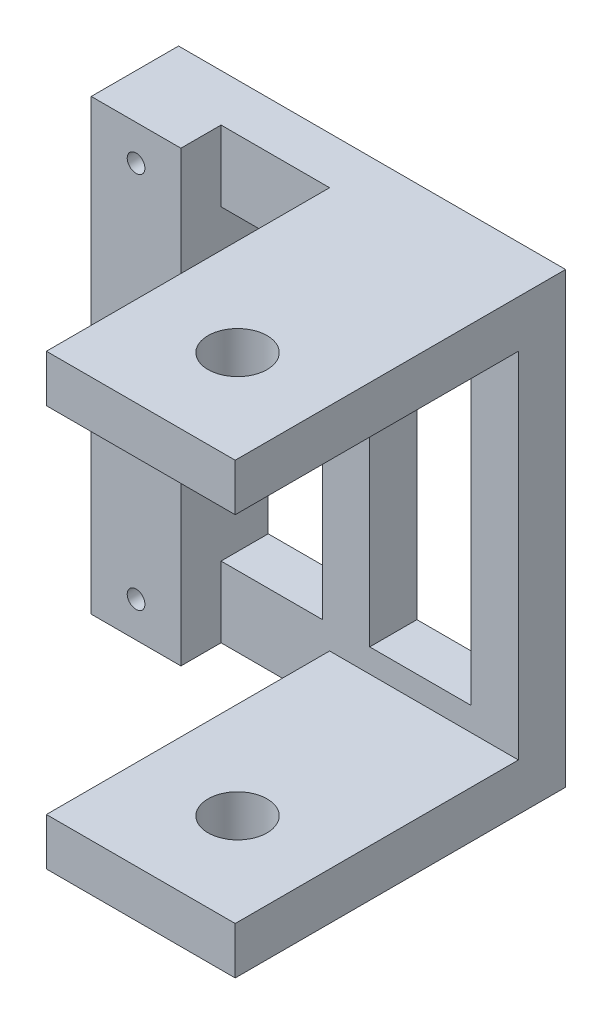
from build123d import *

# Parameters (mm, degrees)
SKETCH_2_W          = 16.4
SKETCH_2_H          = 19
SKETCH_2_W_2        = 4.3
SKETCH_2_H_2        = 13
EXTRUDE_1_DEPTH     = 2
SKETCH_3_W          = 8
SKETCH_3_H          = 2
EXTRUDE_2_DEPTH     = 12
SKETCH_10_W         = 3.8
SKETCH_10_H         = 19
EXTRUDE_4_DEPTH     = 1.7
CUT_EXTRUDE_2_REACH = 21.506
CUT_EXTRUDE_START   = 1.7
SKETCH_9_R          = 0.375
SKETCH_11_R         = 1.25
CUT_EXTRUDE_3_DEPTH = 26.294465798


with BuildPart() as part:
    # 草图2 → 凸台-拉伸1 (new body)
    with BuildSketch(Plane.XY):
        with Locations((-0.9, 0)):
            Rectangle(SKETCH_2_W, SKETCH_2_H)
        with Locations((-3.15, 0)):
            Rectangle(SKETCH_2_W_2, SKETCH_2_H_2, mode=Mode.SUBTRACT)
        with Locations((3.15, 0)):
            Rectangle(SKETCH_2_W_2, SKETCH_2_H_2, mode=Mode.SUBTRACT)
    extrude(amount=EXTRUDE_1_DEPTH)

    # 草图3 → 凸台-拉伸2 (add)
    with BuildSketch(Plane.XY.offset(2)):
        with Locations((3.3, 8.5)):
            Rectangle(SKETCH_3_W, SKETCH_3_H)
        with Locations((3.3, -8.5)):
            Rectangle(SKETCH_3_W, SKETCH_3_H)
    extrude(amount=EXTRUDE_2_DEPTH)

    # 草图10 → 凸台-拉伸4 (add)
    with BuildSketch(Plane.XY.offset(2)):
        with Locations((-7.2, 0)):
            Rectangle(SKETCH_10_W, SKETCH_10_H)
    extrude(amount=EXTRUDE_4_DEPTH)

    # 草图9 → 切除-拉伸2 (cut, up to next)
    with BuildSketch(Plane.XY.offset(2).offset(CUT_EXTRUDE_START), mode=Mode.PRIVATE) as cut_extrude_2_sk1:
        with Locations((-7.2, 8)):
            Circle(SKETCH_9_R)
    cut_extrude_2_tool1 = extrude(cut_extrude_2_sk1.sketch, amount=-CUT_EXTRUDE_2_REACH, mode=Mode.PRIVATE) & part.part
    # 草图9 → 切除-拉伸2 (cut, up to next)
    with BuildSketch(Plane.XY.offset(2).offset(CUT_EXTRUDE_START), mode=Mode.PRIVATE) as cut_extrude_2_sk2:
        with Locations((-7.2, -8)):
            Circle(SKETCH_9_R)
    cut_extrude_2_tool2 = extrude(cut_extrude_2_sk2.sketch, amount=-CUT_EXTRUDE_2_REACH, mode=Mode.PRIVATE) & part.part
    add(cut_extrude_2_tool1.solids().sort_by_distance((-7.2, 8, 3.7))[0], mode=Mode.SUBTRACT)
    add(cut_extrude_2_tool2.solids().sort_by_distance((-7.2, -8, 3.7))[0], mode=Mode.SUBTRACT)

    # 草图11 → 切除-拉伸3 (cut, through all)
    with BuildSketch(Plane.XZ.offset(9.5)):
        with Locations((3.4, 10)):
            Circle(SKETCH_11_R)
    extrude(amount=-CUT_EXTRUDE_3_DEPTH, mode=Mode.SUBTRACT)


solid = part.part
